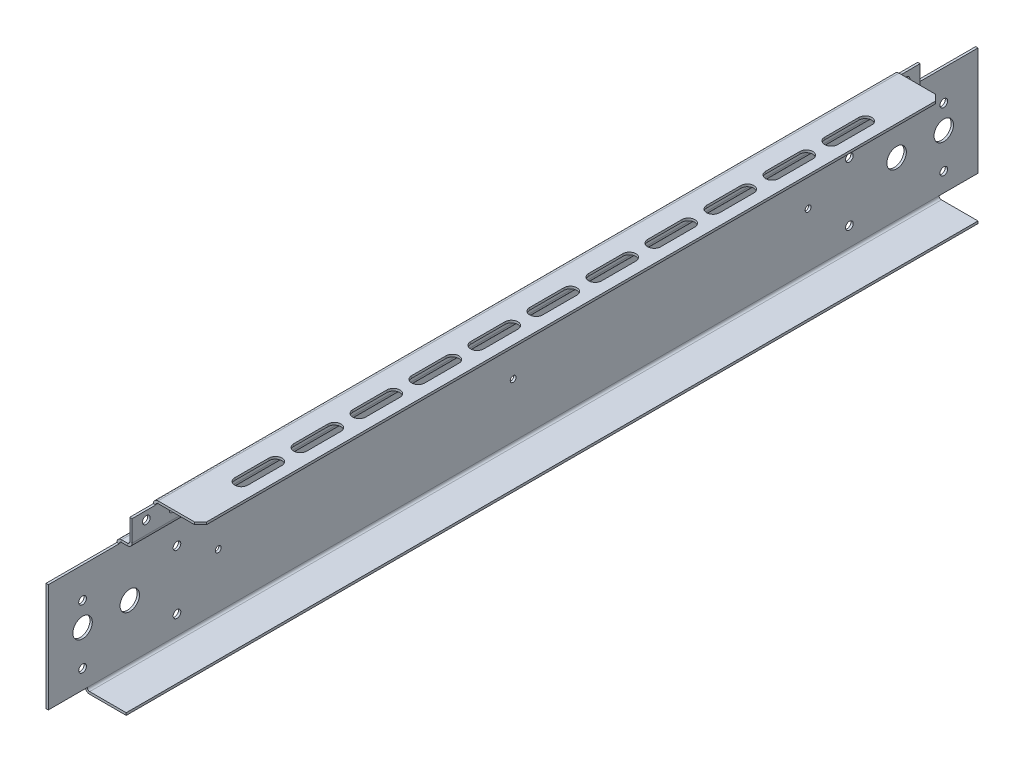
from build123d import *

# Parameters (mm, degrees)
SM_BASE_FLANGE_1_DEPTH = 394
SKETCH_6_W             = 40
SKETCH_6_H             = 80
CUT_EXTRUDE_1_DEPTH    = 4
SKETCH_8_W             = 13
SKETCH_8_H             = 60
CUT_EXTRUDE_2_DEPTH    = 24
SKETCH_9_W             = 35
SKETCH_9_H             = 33
CUT_EXTRUDE_3_DEPTH    = 4
SKETCH_10_R            = 8.25
SKETCH_10_R_2          = 3.25
SKETCH_10_R_3          = 2.5
CUT_EXTRUDE_4_DEPTH    = 10
SKETCH_11_R            = 2.5
SKETCH_11_R_2          = 3.25
CUT_EXTRUDE_5_DEPTH    = 10
CUT_EXTRUDE_6_DEPTH    = 10
OTHER_START            = 229.809703886
OTHER_1_OUTLINE_W      = 445.809703886
OTHER_1_OUTLINE_H      = 4
OTHER_1_DEPTH          = 3.535533906
OTHER_START_2          = -214.2533547
OTHER_1_2_OUTLINE_W    = 4.190296114
OTHER_1_2_OUTLINE_H    = 4
OTHER_1_2_DEPTH        = 7.071067812


# Read off the part's stored shape, not the designer's step: Затупленный угол1
# Sheet-metal steps are written as plain solids
with BuildPart() as part:
    # Sketch 1 → Sm Base Flange 1 (new, symmetric)
    with BuildSketch(Plane.XY):
        with BuildLine():
            Line((0, 0), (-31, 0))
            ThreePointArc((-31, 0), (-33.828427125, 1.171572875), (-35, 4))
            Line((-35, 4), (-35, 96))
            ThreePointArc((-35, 96), (-33.828427125, 98.828427125), (-31, 100))
            Line((-31, 100), (-26, 100))
            ThreePointArc((-26, 100), (-24.585786438, 100.585786438), (-24, 102))
            Line((-24, 102), (-24, 120))
            ThreePointArc((-24, 120), (-22.828427125, 122.828427125), (-20, 124))
            Line((-20, 124), (16, 124))
            Line((16, 124), (16, 122))
            Line((16, 122), (-20, 122))
            ThreePointArc((-20, 122), (-21.414213562, 121.414213562), (-22, 120))
            Line((-22, 120), (-22, 102))
            ThreePointArc((-22, 102), (-23.171572875, 99.171572875), (-26, 98))
            Line((-26, 98), (-31, 98))
            ThreePointArc((-31, 98), (-32.414213562, 97.414213562), (-33, 96))
            Line((-33, 96), (-33, 4))
            ThreePointArc((-33, 4), (-32.414213562, 2.585786438), (-31, 2))
            Line((-31, 2), (0, 2))
            Line((0, 2), (0, 0))
        make_face()
    extrude(amount=SM_BASE_FLANGE_1_DEPTH, both=True)

    # Эскиз6 → Вырез-Вытянуть1 (cut)
    with BuildSketch(Plane(origin=(0, 124, 0), x_dir=(1, 0, 0), z_dir=(0, 1, 0))):
        with Locations((-4, -354)):
            Rectangle(SKETCH_6_W, SKETCH_6_H)
        with Locations((-4, 354)):
            Rectangle(SKETCH_6_W, SKETCH_6_H)
    extrude(amount=-CUT_EXTRUDE_1_DEPTH, mode=Mode.SUBTRACT)

    # Эскиз8 → Вырез-Вытянуть2 (cut)
    with BuildSketch(Plane(origin=(0, 120, 0), x_dir=(1, 0, 0), z_dir=(0, 1, 0))):
        with Locations((-28.5, 364)):
            Rectangle(SKETCH_8_W, SKETCH_8_H)
        with Locations((-28.5, -364)):
            Rectangle(SKETCH_8_W, SKETCH_8_H)
    extrude(amount=-CUT_EXTRUDE_2_DEPTH, mode=Mode.SUBTRACT)

    # Эскиз9 → Вырез-Вытянуть3 (cut)
    with BuildSketch(Plane.XZ):
        with Locations((-17.5, -377.5)):
            Rectangle(SKETCH_9_W, SKETCH_9_H)
        with Locations((-17.5, 377.5)):
            Rectangle(SKETCH_9_W, SKETCH_9_H)
    extrude(amount=-CUT_EXTRUDE_3_DEPTH, mode=Mode.SUBTRACT)

    # Эскиз10 → Вырез-Вытянуть4 (cut)
    with BuildSketch(Plane.ZY.offset(35)):
        with Locations((-365, 50)):
            Circle(SKETCH_10_R)
        with Locations((-365, 20)):
            Circle(SKETCH_10_R_2)
        with Locations((-365, 70)):
            Circle(SKETCH_10_R_2)
        with Locations((-285, 20)):
            Circle(SKETCH_10_R_2)
        with Locations((-285, 70)):
            Circle(SKETCH_10_R_2)
        with Locations((-325, 50)):
            Circle(SKETCH_10_R)
        with Locations(Location((325, 50, 0), (0, 0, 180))):
            Circle(SKETCH_10_R)
        with Locations(Location((285, 70, 0), (0, 0, 180))):
            Circle(SKETCH_10_R_2)
        with Locations(Location((285, 20, 0), (0, 0, 180))):
            Circle(SKETCH_10_R_2)
        with Locations(Location((365, 70, 0), (0, 0, 180))):
            Circle(SKETCH_10_R_2)
        with Locations(Location((365, 20, 0), (0, 0, 180))):
            Circle(SKETCH_10_R_2)
        with Locations(Location((365, 50, 0), (0, 0, 180))):
            Circle(SKETCH_10_R)
        with Locations((-250, 50)):
            Circle(SKETCH_10_R_3)
        with Locations((0, 50)):
            Circle(SKETCH_10_R_3)
        with Locations((250, 50)):
            Circle(SKETCH_10_R_3)
    extrude(amount=-CUT_EXTRUDE_4_DEPTH, mode=Mode.SUBTRACT)

    # Эскиз11 → Вырез-Вытянуть5 (cut)
    with BuildSketch(Plane.ZY.offset(24)):
        with Locations((300, 110)):
            Circle(SKETCH_11_R)
        with Locations((275, 110)):
            Circle(SKETCH_11_R)
        with Locations((250, 110)):
            Circle(SKETCH_11_R)
        with Locations((225, 110)):
            Circle(SKETCH_11_R)
        with Locations((322, 113)):
            Circle(SKETCH_11_R_2)
        with Locations(Location((-322, 113, 0), (0, 0, 180))):
            Circle(SKETCH_11_R_2)
        with Locations(Location((-225, 110, 0), (0, 0, 180))):
            Circle(SKETCH_11_R)
        with Locations(Location((-250, 110, 0), (0, 0, 180))):
            Circle(SKETCH_11_R)
        with Locations(Location((-275, 110, 0), (0, 0, 180))):
            Circle(SKETCH_11_R)
        with Locations(Location((-300, 110, 0), (0, 0, 180))):
            Circle(SKETCH_11_R)
    extrude(amount=-CUT_EXTRUDE_5_DEPTH, mode=Mode.SUBTRACT)

    # Эскиз12 → Вырез-Вытянуть6 (cut)
    with BuildSketch(Plane(origin=(0, 124, 0), x_dir=(1, 0, 0), z_dir=(0, 1, 0))):
        with BuildLine():
            Line((-4.5, 235.5), (-4.5, 264.5))
            ThreePointArc((-4.5, 264.5), (1, 270), (6.5, 264.5))
            Line((6.5, 264.5), (6.5, 235.5))
            ThreePointArc((6.5, 235.5), (1, 230), (-4.5, 235.5))
        make_face()
        with BuildLine():
            Line((-4.5, -14.5), (-4.5, 14.5))
            ThreePointArc((-4.5, 14.5), (1, 20), (6.5, 14.5))
            Line((6.5, 14.5), (6.5, -14.5))
            ThreePointArc((6.5, -14.5), (1, -20), (-4.5, -14.5))
        make_face()
        with BuildLine():
            Line((-4.5, 35.5), (-4.5, 64.5))
            ThreePointArc((-4.5, 64.5), (1, 70), (6.5, 64.5))
            Line((6.5, 64.5), (6.5, 35.5))
            ThreePointArc((6.5, 35.5), (1, 30), (-4.5, 35.5))
        make_face()
        with BuildLine():
            Line((-4.5, 85.5), (-4.5, 114.5))
            ThreePointArc((-4.5, 114.5), (1, 120), (6.5, 114.5))
            Line((6.5, 114.5), (6.5, 85.5))
            ThreePointArc((6.5, 85.5), (1, 80), (-4.5, 85.5))
        make_face()
        with BuildLine():
            Line((-4.5, 135.5), (-4.5, 164.5))
            ThreePointArc((-4.5, 164.5), (1, 170), (6.5, 164.5))
            Line((6.5, 164.5), (6.5, 135.5))
            ThreePointArc((6.5, 135.5), (1, 130), (-4.5, 135.5))
        make_face()
        with BuildLine():
            Line((-4.5, 185.5), (-4.5, 214.5))
            ThreePointArc((-4.5, 214.5), (1, 220), (6.5, 214.5))
            Line((6.5, 214.5), (6.5, 185.5))
            ThreePointArc((6.5, 185.5), (1, 180), (-4.5, 185.5))
        make_face()
        with BuildLine():
            Line((-4.5, -64.5), (-4.5, -35.5))
            ThreePointArc((-4.5, -35.5), (1, -30), (6.5, -35.5))
            Line((6.5, -35.5), (6.5, -64.5))
            ThreePointArc((6.5, -64.5), (1, -70), (-4.5, -64.5))
        make_face()
        with BuildLine():
            Line((-4.5, -114.5), (-4.5, -85.5))
            ThreePointArc((-4.5, -85.5), (1, -80), (6.5, -85.5))
            Line((6.5, -85.5), (6.5, -114.5))
            ThreePointArc((6.5, -114.5), (1, -120), (-4.5, -114.5))
        make_face()
        with BuildLine():
            Line((-4.5, -164.5), (-4.5, -135.5))
            ThreePointArc((-4.5, -135.5), (1, -130), (6.5, -135.5))
            Line((6.5, -135.5), (6.5, -164.5))
            ThreePointArc((6.5, -164.5), (1, -170), (-4.5, -164.5))
        make_face()
        with BuildLine():
            Line((-4.5, -214.5), (-4.5, -185.5))
            ThreePointArc((-4.5, -185.5), (1, -180), (6.5, -185.5))
            Line((6.5, -185.5), (6.5, -214.5))
            ThreePointArc((6.5, -214.5), (1, -220), (-4.5, -214.5))
        make_face()
        with BuildLine():
            Line((-4.5, -264.5), (-4.5, -235.5))
            ThreePointArc((-4.5, -235.5), (1, -230), (6.5, -235.5))
            Line((6.5, -235.5), (6.5, -264.5))
            ThreePointArc((6.5, -264.5), (1, -270), (-4.5, -264.5))
        make_face()
    extrude(amount=-CUT_EXTRUDE_6_DEPTH, mode=Mode.SUBTRACT)

    # Other 1 outline → Other 1 (cut)
    with BuildSketch(Plane(origin=(0, 0, 0), x_dir=(0.707106781186546, 0, -0.707106781186549), z_dir=(0.707106781186549, 0, 0.707106781186546)).offset(OTHER_START)):
        with Locations((6.904851943, 123)):
            Rectangle(OTHER_1_OUTLINE_W, OTHER_1_OUTLINE_H)
    extrude(amount=OTHER_1_DEPTH, mode=Mode.SUBTRACT)

    # Other 1 2 outline → Other 1 2 (cut)
    with BuildSketch(Plane(origin=(0, 0, 0), x_dir=(0.707106781186546, 0, -0.707106781186549), z_dir=(0.707106781186549, 0, 0.707106781186546)).offset(OTHER_START_2)):
        with Locations((231.904851943, 123)):
            Rectangle(OTHER_1_2_OUTLINE_W, OTHER_1_2_OUTLINE_H)
    extrude(amount=OTHER_1_2_DEPTH, mode=Mode.SUBTRACT)


solid = part.part
